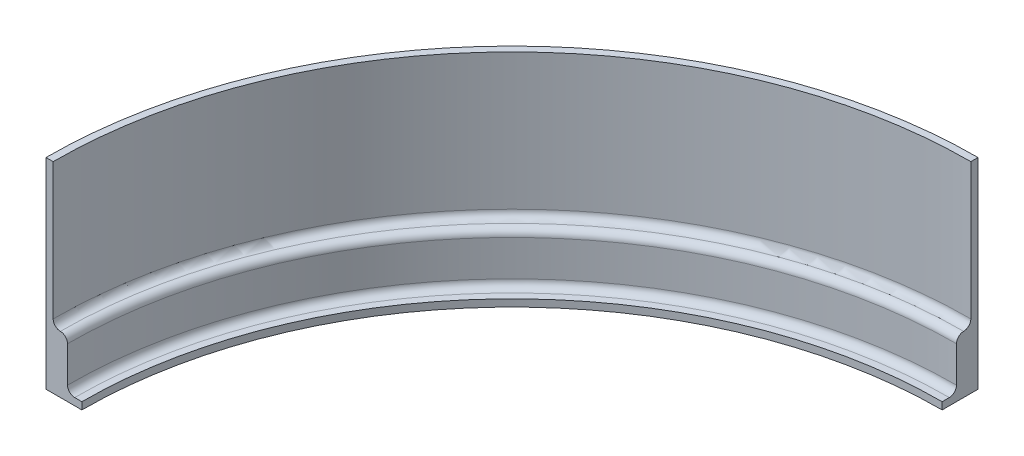
from build123d import *

# Parameters (mm, degrees)
BOTTOM_LEVEL_DEPTH = 5
MID_LEVEL_DEPTH    = 35
GUARD_RAIL_DEPTH   = 100
ROUNDING_R         = 5


with BuildPart() as part:
    # Sketch1 → Bottom level (new body)
    with BuildSketch(Plane(origin=(0, 0, 0), x_dir=(1, 0, 0), z_dir=(0, 1, 0))):
        with BuildLine():
            Line((300, 300), (300, 325))
            ThreePointArc((300, 325), (70.190296114, 229.809703886), (-25, 0))
            Line((-25, 0), (0, 0))
            ThreePointArc((0, 0), (87.867965644, 212.132034356), (300, 300))
        make_face()
    extrude(amount=BOTTOM_LEVEL_DEPTH)

    # Sketch2 → Mid level (add)
    with BuildSketch(Plane(origin=(0, 5, 0), x_dir=(1, 0, 0), z_dir=(0, 1, 0))):
        with BuildLine():
            Line((-25, 0), (-10, 0))
            ThreePointArc((-10, 0), (80.796897832, 219.203102168), (300, 310))
            Line((300, 310), (300, 325))
            ThreePointArc((300, 325), (70.190296114, 229.809703886), (-25, 0))
        make_face()
    extrude(amount=MID_LEVEL_DEPTH)

    # Sketch3 → Guard rail (add)
    with BuildSketch(Plane(origin=(0, 40, 0), x_dir=(1, 0, 0), z_dir=(0, 1, 0))):
        with BuildLine():
            Line((-25, 0), (-20, 0))
            ThreePointArc((-20, 0), (73.72583002, 226.27416998), (300, 320))
            Line((300, 320), (300, 325))
            ThreePointArc((300, 325), (70.190296114, 229.809703886), (-25, 0))
        make_face()
    extrude(amount=GUARD_RAIL_DEPTH)

    # Rounding
    rounding_edges = [part.edges().sort_by_distance(p)[0] for p in [
        (80.796897832, 5, -219.203102168),
        (80.796897832, 40, -219.203102168),
        (73.72583002, 40, -226.27416998),
    ]]
    fillet(rounding_edges, radius=ROUNDING_R - 0.0001)  # a hair under: the kernel refuses the full size


solid = part.part
